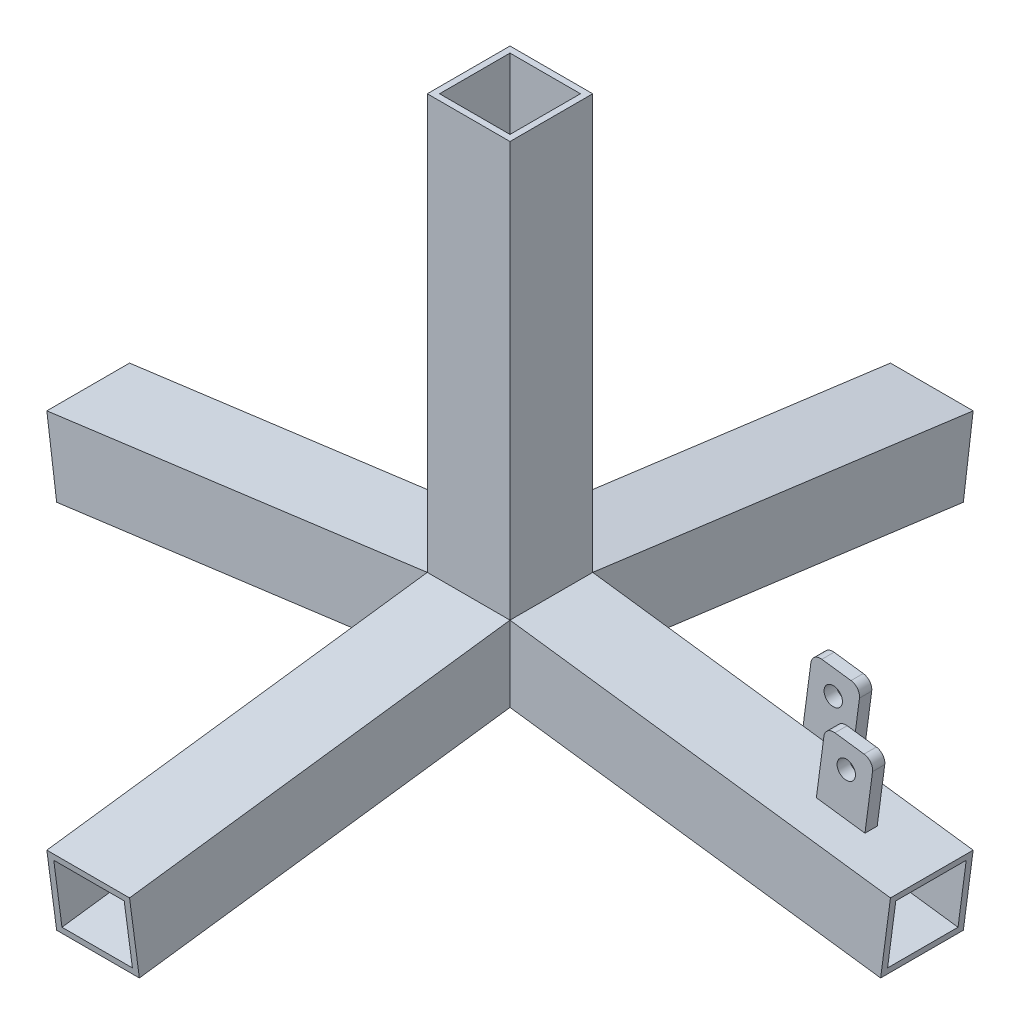
from build123d import *

# Parameters (mm, degrees)
SKETCH1_W           = 42.8625
SKETCH1_H           = 42.8625
BOSS_EXTRUDE1_DEPTH = 254
SHELL1_T            = -3.175
BOSS_EXTRUDE2_DEPTH = 21.43125
CIRPATTERN1_START   = -21.43125
CIRPATTERN1_DEPTH   = 42.8625
CIRPATTERN1_2_DEPTH = 42.8625
BOSS_EXTRUDE3_DEPTH = 6.35
SKETCH4_R           = 4.7625
CUT_EXTRUDE1_DEPTH  = 416.95027213
BOSS_EXTRUDE4_DEPTH = 3.175
SKETCH6_R           = 4.7625
CUT_EXTRUDE2_DEPTH  = 402.863889424
FILLET1_R           = 5.08
SHELL3_START        = -18.25625
SHELL3_DEPTH        = 36.5125
SHELL3_2_DEPTH      = 36.5125
SHELL3_START_2      = -24.60625
SHELL3_3_DEPTH      = 6.35


with BuildPart() as part:
    # Sketch1 → Boss-Extrude1 (new body)
    with BuildSketch(Plane(origin=(0, 0, 0), x_dir=(1, 0, 0), z_dir=(0, 1, 0))):
        Rectangle(SKETCH1_W, SKETCH1_H)
    extrude(amount=BOSS_EXTRUDE1_DEPTH)

    # Shell1
    shell1_openings = [part.faces().sort_by_distance(p)[0] for p in [
        (0, 254, 0),
    ]]
    offset(amount=SHELL1_T, openings=shell1_openings, kind=Kind.INTERSECTION)

    # Sketch2 → Boss-Extrude2 (add, symmetric)
    with BuildSketch(Plane.XY):
        Polygon((21.43125, 0), (213.51875, -25.4), (218.609622268, 13.099721526), (21.43125, 39.172894719), align=None)
    extrude(amount=BOSS_EXTRUDE2_DEPTH, both=True)

    # CirPattern1: read off the stored shape, not the designer's step
    # CirPattern1 outline → CirPattern1 (add)
    with BuildSketch(Plane.YZ.offset(CIRPATTERN1_START)):
        Polygon((13.099721526, -218.609622268), (39.172894719, -21.43125), (0, -21.43125), (-25.4, -213.51875), align=None)
        Polygon((-25.4, 213.51875), (0, 21.43125), (39.172894719, 21.43125), (13.099721526, 218.609622268), align=None)
    extrude(amount=CIRPATTERN1_DEPTH)

    # CirPattern1 2 outline → CirPattern1 2 (add)
    with BuildSketch(Plane.XY.offset(CIRPATTERN1_START)):
        Polygon((-213.51875, -25.4), (-21.43125, 0), (-21.43125, 39.172894719), (-218.609622268, 13.099721526), align=None)
    extrude(amount=CIRPATTERN1_2_DEPTH)

    # Sketch3 → Boss-Extrude3 (add)
    with BuildSketch(Plane(origin=(0, 0, -21.43125), x_dir=(-1, 0, 0), z_dir=(0, 0, -1))):
        Polygon((-153.063997925, 1.80984108), (-127.883188972, 5.139534826), (-135.166894041, 60.222554412), (-160.347702995, 56.892860666), align=None)
    extrude(amount=BOSS_EXTRUDE3_DEPTH)

    # Sketch4 → Cut-Extrude1 (cut, through all)
    with BuildSketch(Plane(origin=(0, 0, -27.78125), x_dir=(-1, 0, 0), z_dir=(0, 0, -1))):
        with Locations((-146.092451645, 45.967303062)):
            Circle(SKETCH4_R)
    extrude(amount=-CUT_EXTRUDE1_DEPTH, mode=Mode.SUBTRACT)

    # Sketch5 → Boss-Extrude4 (add, symmetric)
    with BuildSketch(Plane.XY):
        Polygon((161.952802122, 20.591532454), (166.531131023, 55.215144766), (191.711939977, 51.88545102), (187.133611076, 17.261838709), align=None)
    extrude(amount=BOSS_EXTRUDE4_DEPTH, both=True)

    # Sketch6 → Cut-Extrude2 (cut, through all)
    with BuildSketch(Plane.XY.offset(3.175)):
        with Locations((177.456688627, 40.959893416)):
            Circle(SKETCH6_R)
    extrude(amount=-CUT_EXTRUDE2_DEPTH, mode=Mode.SUBTRACT)

    # Fillet1
    fillet1_edges = [part.edges().sort_by_distance(p)[0] for p in [
        (160.347702995, 56.892860666, -24.60625),
        (135.166894041, 60.222554412, -24.60625),
        (191.711939977, 51.88545102, 0),
        (166.531131023, 55.215144766, 0),
    ]]
    fillet(fillet1_edges, radius=FILLET1_R)

    # Shell3: read off the stored shape, not the designer's step
    # Shell3 outline → Shell3 (cut)
    with BuildSketch(Plane.YZ.offset(SHELL3_START)):
        Polygon((9.952120407, -218.19341055), (35.970257339, -21.43125), (3.175, -21.43125), (3.175, -21.640257682), (-22.252398881, -213.934961718), align=None)
        Polygon((3.175, 21.640257682), (3.175, 21.43125), (35.970257339, 21.43125), (9.952120407, 218.19341055), (-22.252398881, 213.934961718), align=None)
    extrude(amount=SHELL3_DEPTH, mode=Mode.SUBTRACT)

    # Shell3 2 outline → Shell3 2 (cut)
    with BuildSketch(Plane.XY.offset(SHELL3_START)):
        Polygon((-21.640257682, 3.175), (-21.43125, 3.175), (-21.43125, 35.970257339), (-218.19341055, 9.952120407), (-213.934961718, -22.252398881), align=None)
        Polygon((21.43125, 35.970257339), (21.43125, 3.175), (21.640257682, 3.175), (213.934961718, -22.252398881), (218.19341055, 9.952120407), align=None)
    extrude(amount=SHELL3_2_DEPTH, mode=Mode.SUBTRACT)

    # Shell3 3 outline → Shell3 3 (cut)
    with BuildSketch(Plane.XY.offset(SHELL3_START_2)):
        Polygon((152.093787046, 18.69256649), (133.208180331, 21.189836799), (131.447001809, 7.870924227), (150.332608524, 5.373653917), align=None)
    extrude(amount=SHELL3_3_DEPTH, mode=Mode.SUBTRACT)


solid = part.part
